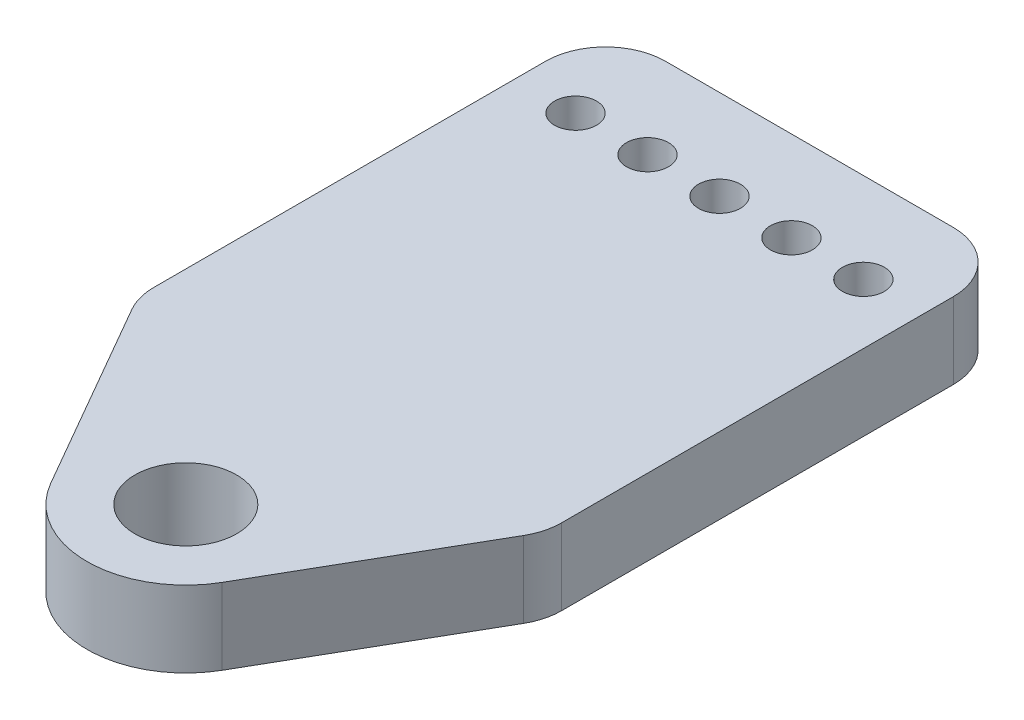
from build123d import *

# Parameters (mm, degrees)
SKETCH1_R           = 1.75
SKETCH1_R_2         = 4.25
BOSS_EXTRUDE1_DEPTH = 6.35
FILLET1_R           = 5


with BuildPart() as part:
    # Sketch1 → Boss-Extrude1 (new body)
    with BuildSketch(Plane(origin=(0, 0, 0), x_dir=(1, 0, 0), z_dir=(0, 1, 0))):
        with BuildLine():
            Line((-5, 7.5), (29, 7.5))
            Line((29, 7.5), (29, -31.5))
            Line((29, -31.5), (19.150459769, -48.615024313))
            ThreePointArc((19.150459769, -48.615024313), (12, -52.75), (4.849540231, -48.615024313))
            Line((4.849540231, -48.615024313), (-5, -31.5))
            Line((-5, -31.5), (-5, 7.5))
        make_face()
        Circle(SKETCH1_R, mode=Mode.SUBTRACT)
        with Locations((6, 0)):
            Circle(SKETCH1_R, mode=Mode.SUBTRACT)
        with Locations((12, 0)):
            Circle(SKETCH1_R, mode=Mode.SUBTRACT)
        with Locations((18, 0)):
            Circle(SKETCH1_R, mode=Mode.SUBTRACT)
        with Locations((24, 0)):
            Circle(SKETCH1_R, mode=Mode.SUBTRACT)
        with Locations((12, -44.5)):
            Circle(SKETCH1_R_2, mode=Mode.SUBTRACT)
    extrude(amount=BOSS_EXTRUDE1_DEPTH)

    # Fillet1
    fillet1_edges = [part.edges().sort_by_distance(p)[0] for p in [
        (-5, 3.175, -7.5),
        (-5, 3.175, 31.5),
        (29, 3.175, 31.5),
        (29, 3.175, -7.5),
    ]]
    fillet(fillet1_edges, radius=FILLET1_R)


solid = part.part
